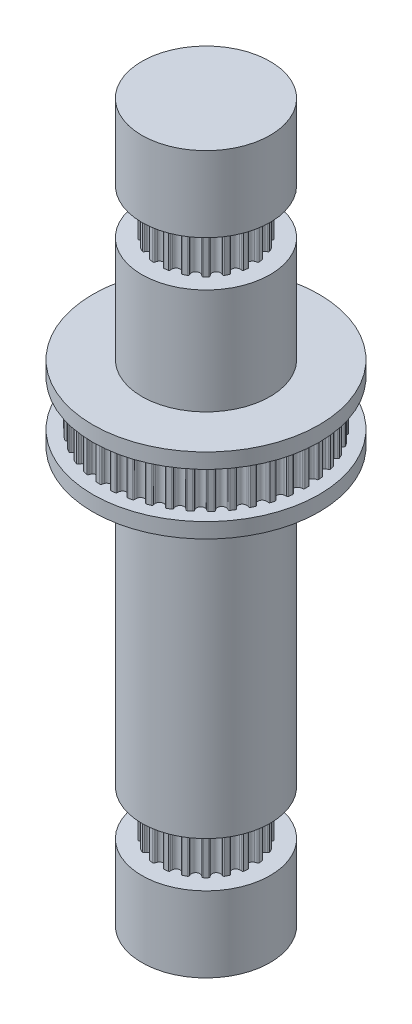
from build123d import *

# Parameters (mm, degrees)
BOSS_EXTRUDE1_DEPTH = 5
SKETCH3_R           = 15
BOSS_EXTRUDE2_DEPTH = 2
BOSS_EXTRUDE3_START = -65
BOSS_EXTRUDE3_DEPTH = 95
SKETCH5_R           = 8.5
BOSS_EXTRUDE4_DEPTH = 10
BOSS_EXTRUDE5_START = -10
SKETCH6_R           = 8.5
BOSS_EXTRUDE5_DEPTH = 10
SKETCH7_R           = 8.5
BOSS_EXTRUDE6_DEPTH = 63


# Read off the part's stored shape, not the designer's step: Boss-Extrude3
with BuildPart() as part:
    # Sketch2 → Boss-Extrude1 (new, symmetric)
    with BuildSketch(Plane(origin=(0, 0, 0), x_dir=(1, 0, 0), z_dir=(0, 1, 0))):
        with BuildLine():
            ThreePointArc((-0.587933358, 13.215922323), (-0.641402083, 13.310557741), (-0.744749539, 13.344233703))
            ThreePointArc((-0.744749539, 13.344233703), (-0.998767701, 13.327628749), (-1.252423529, 13.306188797))
            ThreePointArc((-1.252423529, 13.306188797), (-1.349597538, 13.257485829), (-1.388364385, 13.15593831))
            ThreePointArc((-1.388364385, 13.15593831), (-1.398406592, 13.008375791), (-1.43010426, 12.863908491))
            ThreePointArc((-1.43010426, 12.863908491), (-1.880019146, 12.473112042), (-2.42513485, 12.713931761))
            ThreePointArc((-2.42513485, 12.713931761), (-2.498006764, 12.842637732), (-2.55109764, 12.98068447))
            ThreePointArc((-2.55109764, 12.98068447), (-2.618073842, 13.066293789), (-2.725286134, 13.084190479))
            ThreePointArc((-2.725286134, 13.084190479), (-2.973992282, 13.029911546), (-3.221619526, 12.970905621))
            ThreePointArc((-3.221619526, 12.970905621), (-3.31044938, 12.90826359), (-3.333648361, 12.802072375))
            ThreePointArc((-3.333648361, 12.802072375), (-3.321585353, 12.654661294), (-3.331397251, 12.507083282))
            ThreePointArc((-3.331397251, 12.507083282), (-3.71804177, 12.053595372), (-4.292961299, 12.210480054))
            ThreePointArc((-4.292961299, 12.210480054), (-4.384201924, 12.326887491), (-4.457274617, 12.455479576))
            ThreePointArc((-4.457274617, 12.455479576), (-4.536262157, 12.530150425), (-4.644944339, 12.53186806))
            ThreePointArc((-4.644944339, 12.53186806), (-4.882782791, 12.441127651), (-5.118849866, 12.345873847))
            ThreePointArc((-5.118849866, 12.345873847), (-5.197351254, 12.270692074), (-5.204464142, 12.162229297))
            ThreePointArc((-5.204464142, 12.162229297), (-5.170565386, 12.018262574), (-5.158272331, 11.8708705))
            ThreePointArc((-5.158272331, 11.8708705), (-5.473009485, 11.3648213), (-6.064890087, 11.4342664))
            ThreePointArc((-6.064890087, 11.4342664), (-6.172461257, 11.535774952), (-6.263883445, 11.65203985))
            ThreePointArc((-6.263883445, 11.65203985), (-6.353117871, 11.714104205), (-6.460842164, 11.699604418))
            ThreePointArc((-6.460842164, 11.699604418), (-6.6825, 11.574429522), (-6.901733558, 11.445055653))
            ThreePointArc((-6.901733558, 11.445055653), (-6.968152889, 11.359013573), (-6.959020794, 11.250702115))
            ThreePointArc((-6.959020794, 11.250702115), (-6.904043532, 11.113395729), (-6.869920132, 10.969482086))
            ThreePointArc((-6.869920132, 10.969482086), (-7.105719212, 10.422175899), (-7.701339252, 10.402630129))
            ThreePointArc((-7.701339252, 10.402630129), (-7.822838006, 10.486972263), (-7.930567467, 10.588312808))
            ThreePointArc((-7.930567467, 10.588312808), (-8.028055431, 10.636384255), (-8.132415451, 10.605990945))
            ThreePointArc((-8.132415451, 10.605990945), (-8.332941202, 10.449177763), (-8.530443928, 10.288573827))
            ThreePointArc((-8.530443928, 10.288573827), (-8.583297503, 10.193593478), (-8.55812442, 10.087852838))
            ThreePointArc((-8.55812442, 10.087852838), (-8.483296754, 9.960273987), (-8.428105269, 9.82305357))
            ThreePointArc((-8.428105269, 9.82305357), (-8.579698914, 9.246716311), (-9.165753224, 9.13861629))
            ThreePointArc((-9.165753224, 9.13861629), (-9.29846548, 9.203907943), (-9.420095717, 9.288060355))
            ThreePointArc((-9.420095717, 9.288060355), (-9.523659498, 9.321065057), (-9.622324015, 9.275457161))
            ThreePointArc((-9.622324015, 9.275457161), (-9.797238267, 9.09050864), (-9.968598276, 8.902262264))
            ThreePointArc((-9.968598276, 8.902262264), (-10.006705434, 8.80046535), (-9.966053689, 8.699657599))
            ThreePointArc((-9.966053689, 8.699657599), (-9.873047146, 8.584656183), (-9.798020462, 8.457194269))
            ThreePointArc((-9.798020462, 8.457194269), (-9.86202232, 7.864700361), (-10.425419415, 7.670460865))
            ThreePointArc((-10.425419415, 7.670460865), (-10.566380601, 7.715243529), (-10.699194595, 7.780327982))
            ThreePointArc((-10.699194595, 7.780327982), (-10.806520749, 7.797528667), (-10.897285761, 7.737724991))
            ThreePointArc((-10.897285761, 7.737724991), (-11.042681219, 7.528772576), (-11.184070611, 7.317088872))
            ThreePointArc((-11.184070611, 7.317088872), (-11.206580101, 7.210749369), (-11.151357787, 7.117126385))
            ThreePointArc((-11.151357787, 7.117126385), (-11.042249978, 7.017271346), (-10.949064068, 6.902415222))
            ThreePointArc((-10.949064068, 6.902415222), (-10.924044443, 6.307), (-11.452198964, 6.030960019))
            ThreePointArc((-11.452198964, 6.030960019), (-11.59826024, 6.054233323), (-11.739291145, 6.098795938))
            ThreePointArc((-11.739291145, 6.098795938), (-11.847982184, 6.099808373), (-11.928820151, 6.027144831))
            ThreePointArc((-11.928820151, 6.027144831), (-12.04144892, 5.798856173), (-12.14970929, 5.568463806))
            ThreePointArc((-12.14970929, 5.568463806), (-12.156118287, 5.459957162), (-12.087558979, 5.375610328))
            ThreePointArc((-12.087558979, 5.375610328), (-11.964787193, 5.293132262), (-11.855523675, 5.193447626))
            ThreePointArc((-11.855523675, 5.193447626), (-11.742041465, 4.608411681), (-12.223155312, 4.256737492))
            ThreePointArc((-12.223155312, 4.256737492), (-12.37105391, 4.257981549), (-12.51715133, 4.281026871))
            ThreePointArc((-12.51715133, 4.281026871), (-12.624779275, 4.265828439), (-12.69388441, 4.181928215))
            ThreePointArc((-12.69388441, 4.181928215), (-12.771230549, 3.939402906), (-12.843943541, 3.69544846))
            ThreePointArc((-12.843943541, 3.69544846), (-12.834108878, 3.587198534), (-12.753744078, 3.514012019))
            ThreePointArc((-12.753744078, 3.514012019), (-12.620050833, 3.45075335), (-12.497150475, 3.368466992))
            ThreePointArc((-12.497150475, 3.368466992), (-12.297740684, 2.806879061), (-12.721066569, 2.387426484))
            ThreePointArc((-12.721066569, 2.387426484), (-12.867498678, 2.366613504), (-13.015399038, 2.367626738))
            ThreePointArc((-13.015399038, 2.367626738), (-13.119559659, 2.336556946), (-13.175388267, 2.243294233))
            ThreePointArc((-13.175388267, 2.243294233), (-13.215723992, 1.991949887), (-13.251265316, 1.739882902))
            ThreePointArc((-13.251265316, 1.739882902), (-13.225406685, 1.634307819), (-13.135031609, 1.573916489))
            ThreePointArc((-13.135031609, 1.573916489), (-12.993403392, 1.531290311), (-12.859611583, 1.468240371))
            ThreePointArc((-12.859611583, 1.468240371), (-12.578728698, 0.9426454), (-12.934810219, 0.464784313))
            ThreePointArc((-12.934810219, 0.464784313), (-13.076504789, 0.422379223), (-13.222904238, 0.401337735))
            ThreePointArc((-13.222904238, 0.401337735), (-13.32127076, 0.355090633), (-13.362575722, 0.254548765))
            ThreePointArc((-13.362575722, 0.254548765), (-13.365, 0), (-13.362575722, -0.254548765))
            ThreePointArc((-13.362575722, -0.254548765), (-13.32127076, -0.355090633), (-13.222904238, -0.401337735))
            ThreePointArc((-13.222904238, -0.401337735), (-13.076504789, -0.422379223), (-12.934810219, -0.464784313))
            ThreePointArc((-12.934810219, -0.464784313), (-12.578728698, -0.9426454), (-12.859611583, -1.468240371))
            ThreePointArc((-12.859611583, -1.468240371), (-12.993403392, -1.531290311), (-13.135031609, -1.573916489))
            ThreePointArc((-13.135031609, -1.573916489), (-13.225406685, -1.634307819), (-13.251265316, -1.739882902))
            ThreePointArc((-13.251265316, -1.739882902), (-13.215723992, -1.991949887), (-13.175388267, -2.243294233))
            ThreePointArc((-13.175388267, -2.243294233), (-13.119559659, -2.336556946), (-13.015399038, -2.367626738))
            ThreePointArc((-13.015399038, -2.367626738), (-12.867498678, -2.366613504), (-12.721066569, -2.387426484))
            ThreePointArc((-12.721066569, -2.387426484), (-12.297740684, -2.806879061), (-12.497150475, -3.368466992))
            ThreePointArc((-12.497150475, -3.368466992), (-12.620050833, -3.45075335), (-12.753744078, -3.514012019))
            ThreePointArc((-12.753744078, -3.514012019), (-12.834108878, -3.587198534), (-12.843943541, -3.69544846))
            ThreePointArc((-12.843943541, -3.69544846), (-12.771230549, -3.939402906), (-12.69388441, -4.181928215))
            ThreePointArc((-12.69388441, -4.181928215), (-12.624779275, -4.265828439), (-12.51715133, -4.281026871))
            ThreePointArc((-12.51715133, -4.281026871), (-12.37105391, -4.257981549), (-12.223155312, -4.256737492))
            ThreePointArc((-12.223155312, -4.256737492), (-11.742041465, -4.608411681), (-11.855523675, -5.193447626))
            ThreePointArc((-11.855523675, -5.193447626), (-11.964787193, -5.293132262), (-12.087558979, -5.375610328))
            ThreePointArc((-12.087558979, -5.375610328), (-12.156118287, -5.459957162), (-12.14970929, -5.568463806))
            ThreePointArc((-12.14970929, -5.568463806), (-12.04144892, -5.798856173), (-11.928820151, -6.027144831))
            ThreePointArc((-11.928820151, -6.027144831), (-11.847982184, -6.099808373), (-11.739291145, -6.098795938))
            ThreePointArc((-11.739291145, -6.098795938), (-11.59826024, -6.054233323), (-11.452198964, -6.030960019))
            ThreePointArc((-11.452198964, -6.030960019), (-10.924044443, -6.307), (-10.949064068, -6.902415222))
            ThreePointArc((-10.949064068, -6.902415222), (-11.042249978, -7.017271346), (-11.151357787, -7.117126385))
            ThreePointArc((-11.151357787, -7.117126385), (-11.206580101, -7.210749369), (-11.184070611, -7.317088872))
            ThreePointArc((-11.184070611, -7.317088872), (-11.042681219, -7.528772576), (-10.897285761, -7.737724991))
            ThreePointArc((-10.897285761, -7.737724991), (-10.806520749, -7.797528667), (-10.699194595, -7.780327982))
            ThreePointArc((-10.699194595, -7.780327982), (-10.566380601, -7.715243529), (-10.425419415, -7.670460865))
            ThreePointArc((-10.425419415, -7.670460865), (-9.86202232, -7.864700361), (-9.798020462, -8.457194269))
            ThreePointArc((-9.798020462, -8.457194269), (-9.873047146, -8.584656183), (-9.966053689, -8.699657599))
            ThreePointArc((-9.966053689, -8.699657599), (-10.006705434, -8.80046535), (-9.968598276, -8.902262264))
            ThreePointArc((-9.968598276, -8.902262264), (-9.797238267, -9.09050864), (-9.622324015, -9.275457161))
            ThreePointArc((-9.622324015, -9.275457161), (-9.523659498, -9.321065057), (-9.420095717, -9.288060355))
            ThreePointArc((-9.420095717, -9.288060355), (-9.29846548, -9.203907943), (-9.165753224, -9.13861629))
            ThreePointArc((-9.165753224, -9.13861629), (-8.579698914, -9.246716311), (-8.428105269, -9.82305357))
            ThreePointArc((-8.428105269, -9.82305357), (-8.483296754, -9.960273987), (-8.55812442, -10.087852838))
            ThreePointArc((-8.55812442, -10.087852838), (-8.583297503, -10.193593478), (-8.530443928, -10.288573827))
            ThreePointArc((-8.530443928, -10.288573827), (-8.332941202, -10.449177763), (-8.132415451, -10.605990945))
            ThreePointArc((-8.132415451, -10.605990945), (-8.028055431, -10.636384255), (-7.930567467, -10.588312808))
            ThreePointArc((-7.930567467, -10.588312808), (-7.822838006, -10.486972263), (-7.701339252, -10.402630129))
            ThreePointArc((-7.701339252, -10.402630129), (-7.105719212, -10.422175899), (-6.869920132, -10.969482086))
            ThreePointArc((-6.869920132, -10.969482086), (-6.904043532, -11.113395729), (-6.959020794, -11.250702115))
            ThreePointArc((-6.959020794, -11.250702115), (-6.968152889, -11.359013573), (-6.901733558, -11.445055653))
            ThreePointArc((-6.901733558, -11.445055653), (-6.6825, -11.574429522), (-6.460842164, -11.699604418))
            ThreePointArc((-6.460842164, -11.699604418), (-6.353117871, -11.714104205), (-6.263883445, -11.65203985))
            ThreePointArc((-6.263883445, -11.65203985), (-6.172461257, -11.535774952), (-6.064890087, -11.4342664))
            ThreePointArc((-6.064890087, -11.4342664), (-5.473009485, -11.3648213), (-5.158272331, -11.8708705))
            ThreePointArc((-5.158272331, -11.8708705), (-5.170565386, -12.018262574), (-5.204464142, -12.162229297))
            ThreePointArc((-5.204464142, -12.162229297), (-5.197351254, -12.270692074), (-5.118849866, -12.345873847))
            ThreePointArc((-5.118849866, -12.345873847), (-4.882782791, -12.441127651), (-4.644944339, -12.53186806))
            ThreePointArc((-4.644944339, -12.53186806), (-4.536262157, -12.530150425), (-4.457274617, -12.455479576))
            ThreePointArc((-4.457274617, -12.455479576), (-4.384201924, -12.326887491), (-4.292961299, -12.210480054))
            ThreePointArc((-4.292961299, -12.210480054), (-3.71804177, -12.053595372), (-3.331397251, -12.507083282))
            ThreePointArc((-3.331397251, -12.507083282), (-3.321585353, -12.654661294), (-3.333648361, -12.802072375))
            ThreePointArc((-3.333648361, -12.802072375), (-3.31044938, -12.90826359), (-3.221619526, -12.970905621))
            ThreePointArc((-3.221619526, -12.970905621), (-2.973992282, -13.029911546), (-2.725286134, -13.084190479))
            ThreePointArc((-2.725286134, -13.084190479), (-2.618073842, -13.066293789), (-2.55109764, -12.98068447))
            ThreePointArc((-2.55109764, -12.98068447), (-2.498006764, -12.842637732), (-2.42513485, -12.713931761))
            ThreePointArc((-2.42513485, -12.713931761), (-1.880019146, -12.473112042), (-1.43010426, -12.863908491))
            ThreePointArc((-1.43010426, -12.863908491), (-1.398406592, -13.008375791), (-1.388364385, -13.15593831))
            ThreePointArc((-1.388364385, -13.15593831), (-1.349597538, -13.257485829), (-1.252423529, -13.306188797))
            ThreePointArc((-1.252423529, -13.306188797), (-0.998767701, -13.327628749), (-0.744749539, -13.344233703))
            ThreePointArc((-0.744749539, -13.344233703), (-0.641402083, -13.310557741), (-0.587933358, -13.215922323))
            ThreePointArc((-0.587933358, -13.215922323), (-0.556010261, -13.071504669), (-0.503134896, -12.933375242))
            ThreePointArc((-0.503134896, -12.933375242), (0, -12.614), (0.503134896, -12.933375242))
            ThreePointArc((0.503134896, -12.933375242), (0.556010261, -13.071504669), (0.587933358, -13.215922323))
            ThreePointArc((0.587933358, -13.215922323), (0.641402083, -13.310557741), (0.744749539, -13.344233703))
            ThreePointArc((0.744749539, -13.344233703), (0.998767701, -13.327628749), (1.252423529, -13.306188797))
            ThreePointArc((1.252423529, -13.306188797), (1.349597538, -13.257485829), (1.388364385, -13.15593831))
            ThreePointArc((1.388364385, -13.15593831), (1.398406592, -13.008375791), (1.43010426, -12.863908491))
            ThreePointArc((1.43010426, -12.863908491), (1.880019146, -12.473112042), (2.42513485, -12.713931761))
            ThreePointArc((2.42513485, -12.713931761), (2.498006764, -12.842637732), (2.55109764, -12.98068447))
            ThreePointArc((2.55109764, -12.98068447), (2.618073842, -13.066293789), (2.725286134, -13.084190479))
            ThreePointArc((2.725286134, -13.084190479), (2.973992282, -13.029911546), (3.221619526, -12.970905621))
            ThreePointArc((3.221619526, -12.970905621), (3.31044938, -12.90826359), (3.333648361, -12.802072375))
            ThreePointArc((3.333648361, -12.802072375), (3.321585353, -12.654661294), (3.331397251, -12.507083282))
            ThreePointArc((3.331397251, -12.507083282), (3.71804177, -12.053595372), (4.292961299, -12.210480054))
            ThreePointArc((4.292961299, -12.210480054), (4.384201924, -12.326887491), (4.457274617, -12.455479576))
            ThreePointArc((4.457274617, -12.455479576), (4.536262157, -12.530150425), (4.644944339, -12.53186806))
            ThreePointArc((4.644944339, -12.53186806), (4.882782791, -12.441127651), (5.118849866, -12.345873847))
            ThreePointArc((5.118849866, -12.345873847), (5.197351254, -12.270692074), (5.204464142, -12.162229297))
            ThreePointArc((5.204464142, -12.162229297), (5.170565386, -12.018262574), (5.158272331, -11.8708705))
            ThreePointArc((5.158272331, -11.8708705), (5.473009485, -11.3648213), (6.064890087, -11.4342664))
            ThreePointArc((6.064890087, -11.4342664), (6.172461257, -11.535774952), (6.263883445, -11.65203985))
            ThreePointArc((6.263883445, -11.65203985), (6.353117871, -11.714104205), (6.460842164, -11.699604418))
            ThreePointArc((6.460842164, -11.699604418), (6.6825, -11.574429522), (6.901733558, -11.445055653))
            ThreePointArc((6.901733558, -11.445055653), (6.968152889, -11.359013573), (6.959020794, -11.250702115))
            ThreePointArc((6.959020794, -11.250702115), (6.904043532, -11.113395729), (6.869920132, -10.969482086))
            ThreePointArc((6.869920132, -10.969482086), (7.105719212, -10.422175899), (7.701339252, -10.402630129))
            ThreePointArc((7.701339252, -10.402630129), (7.822838006, -10.486972263), (7.930567467, -10.588312808))
            ThreePointArc((7.930567467, -10.588312808), (8.028055431, -10.636384255), (8.132415451, -10.605990945))
            ThreePointArc((8.132415451, -10.605990945), (8.332941202, -10.449177763), (8.530443928, -10.288573827))
            ThreePointArc((8.530443928, -10.288573827), (8.583297503, -10.193593478), (8.55812442, -10.087852838))
            ThreePointArc((8.55812442, -10.087852838), (8.483296754, -9.960273987), (8.428105269, -9.82305357))
            ThreePointArc((8.428105269, -9.82305357), (8.579698914, -9.246716311), (9.165753224, -9.13861629))
            ThreePointArc((9.165753224, -9.13861629), (9.29846548, -9.203907943), (9.420095717, -9.288060355))
            ThreePointArc((9.420095717, -9.288060355), (9.523659498, -9.321065057), (9.622324015, -9.275457161))
            ThreePointArc((9.622324015, -9.275457161), (9.797238267, -9.09050864), (9.968598276, -8.902262264))
            ThreePointArc((9.968598276, -8.902262264), (10.006705434, -8.80046535), (9.966053689, -8.699657599))
            ThreePointArc((9.966053689, -8.699657599), (9.873047146, -8.584656183), (9.798020462, -8.457194269))
            ThreePointArc((9.798020462, -8.457194269), (9.86202232, -7.864700361), (10.425419415, -7.670460865))
            ThreePointArc((10.425419415, -7.670460865), (10.566380601, -7.715243529), (10.699194595, -7.780327982))
            ThreePointArc((10.699194595, -7.780327982), (10.806520749, -7.797528667), (10.897285761, -7.737724991))
            ThreePointArc((10.897285761, -7.737724991), (11.042681219, -7.528772576), (11.184070611, -7.317088872))
            ThreePointArc((11.184070611, -7.317088872), (11.206580101, -7.210749369), (11.151357787, -7.117126385))
            ThreePointArc((11.151357787, -7.117126385), (11.042249978, -7.017271346), (10.949064068, -6.902415222))
            ThreePointArc((10.949064068, -6.902415222), (10.924044443, -6.307), (11.452198964, -6.030960019))
            ThreePointArc((11.452198964, -6.030960019), (11.59826024, -6.054233323), (11.739291145, -6.098795938))
            ThreePointArc((11.739291145, -6.098795938), (11.847982184, -6.099808373), (11.928820151, -6.027144831))
            ThreePointArc((11.928820151, -6.027144831), (12.04144892, -5.798856173), (12.14970929, -5.568463806))
            ThreePointArc((12.14970929, -5.568463806), (12.156118287, -5.459957162), (12.087558979, -5.375610328))
            ThreePointArc((12.087558979, -5.375610328), (11.964787193, -5.293132262), (11.855523675, -5.193447626))
            ThreePointArc((11.855523675, -5.193447626), (11.742041465, -4.608411681), (12.223155312, -4.256737492))
            ThreePointArc((12.223155312, -4.256737492), (12.37105391, -4.257981549), (12.51715133, -4.281026871))
            ThreePointArc((12.51715133, -4.281026871), (12.624779275, -4.265828439), (12.69388441, -4.181928215))
            ThreePointArc((12.69388441, -4.181928215), (12.771230549, -3.939402906), (12.843943541, -3.69544846))
            ThreePointArc((12.843943541, -3.69544846), (12.834108878, -3.587198534), (12.753744078, -3.514012019))
            ThreePointArc((12.753744078, -3.514012019), (12.620050833, -3.45075335), (12.497150475, -3.368466992))
            ThreePointArc((12.497150475, -3.368466992), (12.297740684, -2.806879061), (12.721066569, -2.387426484))
            ThreePointArc((12.721066569, -2.387426484), (12.867498678, -2.366613504), (13.015399038, -2.367626738))
            ThreePointArc((13.015399038, -2.367626738), (13.119559659, -2.336556946), (13.175388267, -2.243294233))
            ThreePointArc((13.175388267, -2.243294233), (13.215723992, -1.991949887), (13.251265316, -1.739882902))
            ThreePointArc((13.251265316, -1.739882902), (13.225406685, -1.634307819), (13.135031609, -1.573916489))
            ThreePointArc((13.135031609, -1.573916489), (12.993403392, -1.531290311), (12.859611583, -1.468240371))
            ThreePointArc((12.859611583, -1.468240371), (12.578728698, -0.9426454), (12.934810219, -0.464784313))
            ThreePointArc((12.934810219, -0.464784313), (13.076504789, -0.422379223), (13.222904238, -0.401337735))
            ThreePointArc((13.222904238, -0.401337735), (13.32127076, -0.355090633), (13.362575722, -0.254548765))
            ThreePointArc((13.362575722, -0.254548765), (13.365, 0), (13.362575722, 0.254548765))
            ThreePointArc((13.362575722, 0.254548765), (13.32127076, 0.355090633), (13.222904238, 0.401337735))
            ThreePointArc((13.222904238, 0.401337735), (13.076504789, 0.422379223), (12.934810219, 0.464784313))
            ThreePointArc((12.934810219, 0.464784313), (12.578728698, 0.9426454), (12.859611583, 1.468240371))
            ThreePointArc((12.859611583, 1.468240371), (12.993403392, 1.531290311), (13.135031609, 1.573916489))
            ThreePointArc((13.135031609, 1.573916489), (13.225406685, 1.634307819), (13.251265316, 1.739882902))
            ThreePointArc((13.251265316, 1.739882902), (13.215723992, 1.991949887), (13.175388267, 2.243294233))
            ThreePointArc((13.175388267, 2.243294233), (13.119559659, 2.336556946), (13.015399038, 2.367626738))
            ThreePointArc((13.015399038, 2.367626738), (12.867498678, 2.366613504), (12.721066569, 2.387426484))
            ThreePointArc((12.721066569, 2.387426484), (12.297740684, 2.806879061), (12.497150475, 3.368466992))
            ThreePointArc((12.497150475, 3.368466992), (12.620050833, 3.45075335), (12.753744078, 3.514012019))
            ThreePointArc((12.753744078, 3.514012019), (12.834108878, 3.587198534), (12.843943541, 3.69544846))
            ThreePointArc((12.843943541, 3.69544846), (12.771230549, 3.939402906), (12.69388441, 4.181928215))
            ThreePointArc((12.69388441, 4.181928215), (12.624779275, 4.265828439), (12.51715133, 4.281026871))
            ThreePointArc((12.51715133, 4.281026871), (12.37105391, 4.257981549), (12.223155312, 4.256737492))
            ThreePointArc((12.223155312, 4.256737492), (11.742041465, 4.608411681), (11.855523675, 5.193447626))
            ThreePointArc((11.855523675, 5.193447626), (11.964787193, 5.293132262), (12.087558979, 5.375610328))
            ThreePointArc((12.087558979, 5.375610328), (12.156118287, 5.459957162), (12.14970929, 5.568463806))
            ThreePointArc((12.14970929, 5.568463806), (12.04144892, 5.798856173), (11.928820151, 6.027144831))
            ThreePointArc((11.928820151, 6.027144831), (11.847982184, 6.099808373), (11.739291145, 6.098795938))
            ThreePointArc((11.739291145, 6.098795938), (11.59826024, 6.054233323), (11.452198964, 6.030960019))
            ThreePointArc((11.452198964, 6.030960019), (10.924044443, 6.307), (10.949064068, 6.902415222))
            ThreePointArc((10.949064068, 6.902415222), (11.042249978, 7.017271346), (11.151357787, 7.117126385))
            ThreePointArc((11.151357787, 7.117126385), (11.206580101, 7.210749369), (11.184070611, 7.317088872))
            ThreePointArc((11.184070611, 7.317088872), (11.042681219, 7.528772576), (10.897285761, 7.737724991))
            ThreePointArc((10.897285761, 7.737724991), (10.806520749, 7.797528667), (10.699194595, 7.780327982))
            ThreePointArc((10.699194595, 7.780327982), (10.566380601, 7.715243529), (10.425419415, 7.670460865))
            ThreePointArc((10.425419415, 7.670460865), (9.86202232, 7.864700361), (9.798020462, 8.457194269))
            ThreePointArc((9.798020462, 8.457194269), (9.873047146, 8.584656183), (9.966053689, 8.699657599))
            ThreePointArc((9.966053689, 8.699657599), (10.006705434, 8.80046535), (9.968598276, 8.902262264))
            ThreePointArc((9.968598276, 8.902262264), (9.797238267, 9.09050864), (9.622324015, 9.275457161))
            ThreePointArc((9.622324015, 9.275457161), (9.523659498, 9.321065057), (9.420095717, 9.288060355))
            ThreePointArc((9.420095717, 9.288060355), (9.29846548, 9.203907943), (9.165753224, 9.13861629))
            ThreePointArc((9.165753224, 9.13861629), (8.579698914, 9.246716311), (8.428105269, 9.82305357))
            ThreePointArc((8.428105269, 9.82305357), (8.483296754, 9.960273987), (8.55812442, 10.087852838))
            ThreePointArc((8.55812442, 10.087852838), (8.583297503, 10.193593478), (8.530443928, 10.288573827))
            ThreePointArc((8.530443928, 10.288573827), (8.332941202, 10.449177763), (8.132415451, 10.605990945))
            ThreePointArc((8.132415451, 10.605990945), (8.028055431, 10.636384255), (7.930567467, 10.588312808))
            ThreePointArc((7.930567467, 10.588312808), (7.822838006, 10.486972263), (7.701339252, 10.402630129))
            ThreePointArc((7.701339252, 10.402630129), (7.105719212, 10.422175899), (6.869920132, 10.969482086))
            ThreePointArc((6.869920132, 10.969482086), (6.904043532, 11.113395729), (6.959020794, 11.250702115))
            ThreePointArc((6.959020794, 11.250702115), (6.968152889, 11.359013573), (6.901733558, 11.445055653))
            ThreePointArc((6.901733558, 11.445055653), (6.6825, 11.574429522), (6.460842164, 11.699604418))
            ThreePointArc((6.460842164, 11.699604418), (6.353117871, 11.714104205), (6.263883445, 11.65203985))
            ThreePointArc((6.263883445, 11.65203985), (6.172461257, 11.535774952), (6.064890087, 11.4342664))
            ThreePointArc((6.064890087, 11.4342664), (5.473009485, 11.3648213), (5.158272331, 11.8708705))
            ThreePointArc((5.158272331, 11.8708705), (5.170565386, 12.018262574), (5.204464142, 12.162229297))
            ThreePointArc((5.204464142, 12.162229297), (5.197351254, 12.270692074), (5.118849866, 12.345873847))
            ThreePointArc((5.118849866, 12.345873847), (4.882782791, 12.441127651), (4.644944339, 12.53186806))
            ThreePointArc((4.644944339, 12.53186806), (4.536262157, 12.530150425), (4.457274617, 12.455479576))
            ThreePointArc((4.457274617, 12.455479576), (4.384201924, 12.326887491), (4.292961299, 12.210480054))
            ThreePointArc((4.292961299, 12.210480054), (3.71804177, 12.053595372), (3.331397251, 12.507083282))
            ThreePointArc((3.331397251, 12.507083282), (3.321585353, 12.654661294), (3.333648361, 12.802072375))
            ThreePointArc((3.333648361, 12.802072375), (3.31044938, 12.90826359), (3.221619526, 12.970905621))
            ThreePointArc((3.221619526, 12.970905621), (2.973992282, 13.029911546), (2.725286134, 13.084190479))
            ThreePointArc((2.725286134, 13.084190479), (2.618073842, 13.066293789), (2.55109764, 12.98068447))
            ThreePointArc((2.55109764, 12.98068447), (2.498006764, 12.842637732), (2.42513485, 12.713931761))
            ThreePointArc((2.42513485, 12.713931761), (1.880019146, 12.473112042), (1.43010426, 12.863908491))
            ThreePointArc((1.43010426, 12.863908491), (1.398406592, 13.008375791), (1.388364385, 13.15593831))
            ThreePointArc((1.388364385, 13.15593831), (1.349597538, 13.257485829), (1.252423529, 13.306188797))
            ThreePointArc((1.252423529, 13.306188797), (0.998767701, 13.327628749), (0.744749539, 13.344233703))
            ThreePointArc((0.744749539, 13.344233703), (0.641402083, 13.310557741), (0.587933358, 13.215922323))
            ThreePointArc((0.587933358, 13.215922323), (0.556010261, 13.071504669), (0.503134896, 12.933375242))
            ThreePointArc((0.503134896, 12.933375242), (0, 12.614), (-0.503134896, 12.933375242))
            ThreePointArc((-0.503134896, 12.933375242), (-0.556010261, 13.071504669), (-0.587933358, 13.215922323))
        make_face()
    extrude(amount=BOSS_EXTRUDE1_DEPTH, both=True)

    # Sketch3 → Boss-Extrude2 (add)
    with BuildSketch(Plane(origin=(0, 5, 0), x_dir=(1, 0, 0), z_dir=(0, 1, 0))):
        with Locations(Location((0, 0, 0), (0, 0, 270))):
            Circle(SKETCH3_R)
    boss_extrude2 = extrude(amount=-BOSS_EXTRUDE2_DEPTH)

    # Mirror1: Boss-Extrude2 across plane
    add(boss_extrude2.mirror(Plane.ZX))

    # Boss-Extrude3 outline → Boss-Extrude3 (add)
    with BuildSketch(Plane(origin=(0, 5, 0), x_dir=(1, 0, 0), z_dir=(0, 1, 0)).offset(BOSS_EXTRUDE3_START)):
        with BuildLine():
            ThreePointArc((-0.748491413, 6.321844399), (-0.995861805, 6.287623976), (-1.24169972, 6.243727877))
            ThreePointArc((-1.24169972, 6.243727877), (-1.335488259, 6.182397082), (-1.360601883, 6.073185991))
            ThreePointArc((-1.360601883, 6.073185991), (-1.348626745, 5.941196423), (-1.354211129, 5.808782433))
            ThreePointArc((-1.354211129, 5.808782433), (-1.735130423, 5.340182339), (-2.31873683, 5.495389035))
            ThreePointArc((-2.31873683, 5.495389035), (-2.401085682, 5.599231785), (-2.468979114, 5.713052398))
            ThreePointArc((-2.468979114, 5.713052398), (-2.553489131, 5.786644609), (-2.66541499, 5.781134744))
            ThreePointArc((-2.66541499, 5.781134744), (-2.890103521, 5.672147533), (-3.110344632, 5.554431768))
            ThreePointArc((-3.110344632, 5.554431768), (-3.180590575, 5.467120463), (-3.170726968, 5.355494007))
            ThreePointArc((-3.170726968, 5.355494007), (-3.118550916, 5.233664989), (-3.082943807, 5.106006132))
            ThreePointArc((-3.082943807, 5.106006132), (-3.300414192, 4.542630423), (-3.903418375, 4.509896465))
            ThreePointArc((-3.903418375, 4.509896465), (-4.013825961, 4.583209594), (-4.113568955, 4.670479206))
            ThreePointArc((-4.113568955, 4.670479206), (-4.216684002, 4.714354526), (-4.321429178, 4.674527341))
            ThreePointArc((-4.321429178, 4.674527341), (-4.501441769, 4.501441769), (-4.674527341, 4.321429178))
            ThreePointArc((-4.674527341, 4.321429178), (-4.714354526, 4.216684002), (-4.670479206, 4.113568955))
            ThreePointArc((-4.670479206, 4.113568955), (-4.583209594, 4.013825961), (-4.509896465, 3.903418375))
            ThreePointArc((-4.509896465, 3.903418375), (-4.542630423, 3.300414192), (-5.106006132, 3.082943807))
            ThreePointArc((-5.106006132, 3.082943807), (-5.233664989, 3.118550916), (-5.355494007, 3.170726968))
            ThreePointArc((-5.355494007, 3.170726968), (-5.467120463, 3.180590575), (-5.554431768, 3.110344632))
            ThreePointArc((-5.554431768, 3.110344632), (-5.672147533, 2.890103521), (-5.781134744, 2.66541499))
            ThreePointArc((-5.781134744, 2.66541499), (-5.786644609, 2.553489131), (-5.713052398, 2.468979114))
            ThreePointArc((-5.713052398, 2.468979114), (-5.599231785, 2.401085682), (-5.495389035, 2.31873683))
            ThreePointArc((-5.495389035, 2.31873683), (-5.340182339, 1.735130423), (-5.808782433, 1.354211129))
            ThreePointArc((-5.808782433, 1.354211129), (-5.941196423, 1.348626745), (-6.073185991, 1.360601883))
            ThreePointArc((-6.073185991, 1.360601883), (-6.182397082, 1.335488259), (-6.243727877, 1.24169972))
            ThreePointArc((-6.243727877, 1.24169972), (-6.287623976, 0.995861805), (-6.321844399, 0.748491413))
            ThreePointArc((-6.321844399, 0.748491413), (-6.292497599, 0.640340953), (-6.196392216, 0.582708394))
            ThreePointArc((-6.196392216, 0.582708394), (-6.067162156, 0.553310407), (-5.942954637, 0.50708117))
            ThreePointArc((-5.942954637, 0.50708117), (-5.615, 0), (-5.942954637, -0.50708117))
            ThreePointArc((-5.942954637, -0.50708117), (-6.067162156, -0.553310407), (-6.196392216, -0.582708394))
            ThreePointArc((-6.196392216, -0.582708394), (-6.292497599, -0.640340953), (-6.321844399, -0.748491413))
            ThreePointArc((-6.321844399, -0.748491413), (-6.287623976, -0.995861805), (-6.243727877, -1.24169972))
            ThreePointArc((-6.243727877, -1.24169972), (-6.182397082, -1.335488259), (-6.073185991, -1.360601883))
            ThreePointArc((-6.073185991, -1.360601883), (-5.941196423, -1.348626745), (-5.808782433, -1.354211129))
            ThreePointArc((-5.808782433, -1.354211129), (-5.340182339, -1.735130423), (-5.495389035, -2.31873683))
            ThreePointArc((-5.495389035, -2.31873683), (-5.599231785, -2.401085682), (-5.713052398, -2.468979114))
            ThreePointArc((-5.713052398, -2.468979114), (-5.786644609, -2.553489131), (-5.781134744, -2.66541499))
            ThreePointArc((-5.781134744, -2.66541499), (-5.672147533, -2.890103521), (-5.554431768, -3.110344632))
            ThreePointArc((-5.554431768, -3.110344632), (-5.467120463, -3.180590575), (-5.355494007, -3.170726968))
            ThreePointArc((-5.355494007, -3.170726968), (-5.233664989, -3.118550916), (-5.106006132, -3.082943807))
            ThreePointArc((-5.106006132, -3.082943807), (-4.542630423, -3.300414192), (-4.509896465, -3.903418375))
            ThreePointArc((-4.509896465, -3.903418375), (-4.583209594, -4.013825961), (-4.670479206, -4.113568955))
            ThreePointArc((-4.670479206, -4.113568955), (-4.714354526, -4.216684002), (-4.674527341, -4.321429178))
            ThreePointArc((-4.674527341, -4.321429178), (-4.501441769, -4.501441769), (-4.321429178, -4.674527341))
            ThreePointArc((-4.321429178, -4.674527341), (-4.216684002, -4.714354526), (-4.113568955, -4.670479206))
            ThreePointArc((-4.113568955, -4.670479206), (-4.013825961, -4.583209594), (-3.903418375, -4.509896465))
            ThreePointArc((-3.903418375, -4.509896465), (-3.300414192, -4.542630423), (-3.082943807, -5.106006132))
            ThreePointArc((-3.082943807, -5.106006132), (-3.118550916, -5.233664989), (-3.170726968, -5.355494007))
            ThreePointArc((-3.170726968, -5.355494007), (-3.180590575, -5.467120463), (-3.110344632, -5.554431768))
            ThreePointArc((-3.110344632, -5.554431768), (-2.890103521, -5.672147533), (-2.66541499, -5.781134744))
            ThreePointArc((-2.66541499, -5.781134744), (-2.553489131, -5.786644609), (-2.468979114, -5.713052398))
            ThreePointArc((-2.468979114, -5.713052398), (-2.401085682, -5.599231785), (-2.31873683, -5.495389035))
            ThreePointArc((-2.31873683, -5.495389035), (-1.735130423, -5.340182339), (-1.354211129, -5.808782433))
            ThreePointArc((-1.354211129, -5.808782433), (-1.348626745, -5.941196423), (-1.360601883, -6.073185991))
            ThreePointArc((-1.360601883, -6.073185991), (-1.335488259, -6.182397082), (-1.24169972, -6.243727877))
            ThreePointArc((-1.24169972, -6.243727877), (-0.995861805, -6.287623976), (-0.748491413, -6.321844399))
            ThreePointArc((-0.748491413, -6.321844399), (-0.640340953, -6.292497599), (-0.582708394, -6.196392216))
            ThreePointArc((-0.582708394, -6.196392216), (-0.553310407, -6.067162156), (-0.50708117, -5.942954637))
            ThreePointArc((-0.50708117, -5.942954637), (0, -5.615), (0.50708117, -5.942954637))
            ThreePointArc((0.50708117, -5.942954637), (0.553310407, -6.067162156), (0.582708394, -6.196392216))
            ThreePointArc((0.582708394, -6.196392216), (0.640340953, -6.292497599), (0.748491413, -6.321844399))
            ThreePointArc((0.748491413, -6.321844399), (0.995861805, -6.287623976), (1.24169972, -6.243727877))
            ThreePointArc((1.24169972, -6.243727877), (1.335488259, -6.182397082), (1.360601883, -6.073185991))
            ThreePointArc((1.360601883, -6.073185991), (1.348626745, -5.941196423), (1.354211129, -5.808782433))
            ThreePointArc((1.354211129, -5.808782433), (1.735130423, -5.340182339), (2.31873683, -5.495389035))
            ThreePointArc((2.31873683, -5.495389035), (2.401085682, -5.599231785), (2.468979114, -5.713052398))
            ThreePointArc((2.468979114, -5.713052398), (2.553489131, -5.786644609), (2.66541499, -5.781134744))
            ThreePointArc((2.66541499, -5.781134744), (2.890103521, -5.672147533), (3.110344632, -5.554431768))
            ThreePointArc((3.110344632, -5.554431768), (3.180590575, -5.467120463), (3.170726968, -5.355494007))
            ThreePointArc((3.170726968, -5.355494007), (3.118550916, -5.233664989), (3.082943807, -5.106006132))
            ThreePointArc((3.082943807, -5.106006132), (3.300414192, -4.542630423), (3.903418375, -4.509896465))
            ThreePointArc((3.903418375, -4.509896465), (4.013825961, -4.583209594), (4.113568955, -4.670479206))
            ThreePointArc((4.113568955, -4.670479206), (4.216684002, -4.714354526), (4.321429178, -4.674527341))
            ThreePointArc((4.321429178, -4.674527341), (4.501441769, -4.501441769), (4.674527341, -4.321429178))
            ThreePointArc((4.674527341, -4.321429178), (4.714354526, -4.216684002), (4.670479206, -4.113568955))
            ThreePointArc((4.670479206, -4.113568955), (4.583209594, -4.013825961), (4.509896465, -3.903418375))
            ThreePointArc((4.509896465, -3.903418375), (4.542630423, -3.300414192), (5.106006132, -3.082943807))
            ThreePointArc((5.106006132, -3.082943807), (5.233664989, -3.118550916), (5.355494007, -3.170726968))
            ThreePointArc((5.355494007, -3.170726968), (5.467120463, -3.180590575), (5.554431768, -3.110344632))
            ThreePointArc((5.554431768, -3.110344632), (5.672147533, -2.890103521), (5.781134744, -2.66541499))
            ThreePointArc((5.781134744, -2.66541499), (5.786644609, -2.553489131), (5.713052398, -2.468979114))
            ThreePointArc((5.713052398, -2.468979114), (5.599231785, -2.401085682), (5.495389035, -2.31873683))
            ThreePointArc((5.495389035, -2.31873683), (5.340182339, -1.735130423), (5.808782433, -1.354211129))
            ThreePointArc((5.808782433, -1.354211129), (5.941196423, -1.348626745), (6.073185991, -1.360601883))
            ThreePointArc((6.073185991, -1.360601883), (6.182397082, -1.335488259), (6.243727877, -1.24169972))
            ThreePointArc((6.243727877, -1.24169972), (6.287623976, -0.995861805), (6.321844399, -0.748491413))
            ThreePointArc((6.321844399, -0.748491413), (6.292497599, -0.640340953), (6.196392216, -0.582708394))
            ThreePointArc((6.196392216, -0.582708394), (6.067162156, -0.553310407), (5.942954637, -0.50708117))
            ThreePointArc((5.942954637, -0.50708117), (5.615, 0), (5.942954637, 0.50708117))
            ThreePointArc((5.942954637, 0.50708117), (6.067162156, 0.553310407), (6.196392216, 0.582708394))
            ThreePointArc((6.196392216, 0.582708394), (6.292497599, 0.640340953), (6.321844399, 0.748491413))
            ThreePointArc((6.321844399, 0.748491413), (6.287623976, 0.995861805), (6.243727877, 1.24169972))
            ThreePointArc((6.243727877, 1.24169972), (6.182397082, 1.335488259), (6.073185991, 1.360601883))
            ThreePointArc((6.073185991, 1.360601883), (5.941196423, 1.348626745), (5.808782433, 1.354211129))
            ThreePointArc((5.808782433, 1.354211129), (5.340182339, 1.735130423), (5.495389035, 2.31873683))
            ThreePointArc((5.495389035, 2.31873683), (5.599231785, 2.401085682), (5.713052398, 2.468979114))
            ThreePointArc((5.713052398, 2.468979114), (5.786644609, 2.553489131), (5.781134744, 2.66541499))
            ThreePointArc((5.781134744, 2.66541499), (5.672147533, 2.890103521), (5.554431768, 3.110344632))
            ThreePointArc((5.554431768, 3.110344632), (5.467120463, 3.180590575), (5.355494007, 3.170726968))
            ThreePointArc((5.355494007, 3.170726968), (5.233664989, 3.118550916), (5.106006132, 3.082943807))
            ThreePointArc((5.106006132, 3.082943807), (4.542630423, 3.300414192), (4.509896465, 3.903418375))
            ThreePointArc((4.509896465, 3.903418375), (4.583209594, 4.013825961), (4.670479206, 4.113568955))
            ThreePointArc((4.670479206, 4.113568955), (4.714354526, 4.216684002), (4.674527341, 4.321429178))
            ThreePointArc((4.674527341, 4.321429178), (4.501441769, 4.501441769), (4.321429178, 4.674527341))
            ThreePointArc((4.321429178, 4.674527341), (4.216684002, 4.714354526), (4.113568955, 4.670479206))
            ThreePointArc((4.113568955, 4.670479206), (4.013825961, 4.583209594), (3.903418375, 4.509896465))
            ThreePointArc((3.903418375, 4.509896465), (3.300414192, 4.542630423), (3.082943807, 5.106006132))
            ThreePointArc((3.082943807, 5.106006132), (3.118550916, 5.233664989), (3.170726968, 5.355494007))
            ThreePointArc((3.170726968, 5.355494007), (3.180590575, 5.467120463), (3.110344632, 5.554431768))
            ThreePointArc((3.110344632, 5.554431768), (2.890103521, 5.672147533), (2.66541499, 5.781134744))
            ThreePointArc((2.66541499, 5.781134744), (2.553489131, 5.786644609), (2.468979114, 5.713052398))
            ThreePointArc((2.468979114, 5.713052398), (2.401085682, 5.599231785), (2.31873683, 5.495389035))
            ThreePointArc((2.31873683, 5.495389035), (1.735130423, 5.340182339), (1.354211129, 5.808782433))
            ThreePointArc((1.354211129, 5.808782433), (1.348626745, 5.941196423), (1.360601883, 6.073185991))
            ThreePointArc((1.360601883, 6.073185991), (1.335488259, 6.182397082), (1.24169972, 6.243727877))
            ThreePointArc((1.24169972, 6.243727877), (0.995861805, 6.287623976), (0.748491413, 6.321844399))
            ThreePointArc((0.748491413, 6.321844399), (0.640340953, 6.292497599), (0.582708394, 6.196392216))
            ThreePointArc((0.582708394, 6.196392216), (0.553310407, 6.067162156), (0.50708117, 5.942954637))
            ThreePointArc((0.50708117, 5.942954637), (0, 5.615), (-0.50708117, 5.942954637))
            ThreePointArc((-0.50708117, 5.942954637), (-0.553310407, 6.067162156), (-0.582708394, 6.196392216))
            ThreePointArc((-0.582708394, 6.196392216), (-0.640340953, 6.292497599), (-0.748491413, 6.321844399))
        make_face()
    extrude(amount=BOSS_EXTRUDE3_DEPTH)

    # Sketch5 → Boss-Extrude4 (add)
    with BuildSketch(Plane(origin=(0, 35, 0), x_dir=(1, 0, 0), z_dir=(0, 1, 0))):
        with Locations(Location((0, 0, 0), (0, 0, 270))):
            Circle(SKETCH5_R)
    extrude(amount=-BOSS_EXTRUDE4_DEPTH)

    # Sketch6 → Boss-Extrude5 (add)
    with BuildSketch(Plane.XZ.offset(60).offset(BOSS_EXTRUDE5_START)):
        with Locations(Location((0, 0, 0), (0, 0, 90))):
            Circle(SKETCH6_R)
    extrude(amount=BOSS_EXTRUDE5_DEPTH)

    # Sketch7 → Boss-Extrude6 (add)
    with BuildSketch(Plane(origin=(0, 19, 0), x_dir=(-1, 0, 0), z_dir=(0, -1, 0))):
        with Locations(Location((0, 0, 0), (0, 0, 90))):
            Circle(SKETCH7_R)
    extrude(amount=BOSS_EXTRUDE6_DEPTH)


solid = part.part
